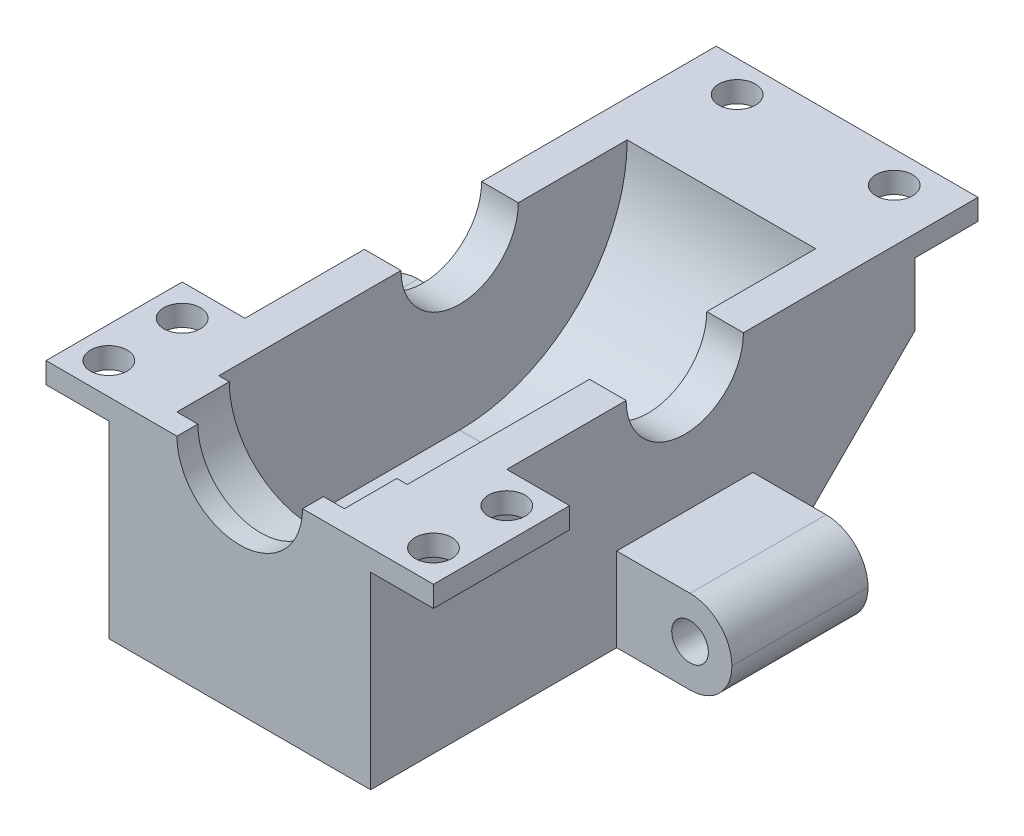
from build123d import *

# Parameters (mm, degrees)
CROQUIS2_W                 = 25
CROQUIS2_H                 = 50
SALIENTE_EXTRUIR2_DEPTH    = 20
CROQUIS19_W                = 25
CROQUIS19_H                = 20
SALIENTE_EXTRUIR8_DEPTH    = 6
CORTAR_EXTRUIR1_DEPTH      = 9
CORTAR_EXTRUIR2_DEPTH      = 39.951893407
CORTAR_EXTRUIR2_DEPTH_BACK = 39.951893407
CROQUIS9_R                 = 8
CORTAR_EXTRUIR3_DEPTH      = 5
SALIENTE_EXTRUIR9_DEPTH    = 2
CROQUIS11_W                = 13
CROQUIS11_H                = 2
SALIENTE_EXTRUIR4_DEPTH    = 6
CROQUIS13_W                = 13
CROQUIS13_H                = 2
SALIENTE_EXTRUIR5_DEPTH    = 6
CROQUIS16_R                = 1.75
CORTAR_EXTRUIR6_DEPTH      = 43.793106922
CROQUIS17_W                = 13
CROQUIS17_H                = 8
SALIENTE_EXTRUIR7_DEPTH    = 11
REDONDEO1_R                = 4
CROQUIS12_R                = 1.75
CORTAR_EXTRUIR4_DEPTH      = 46.180194776
CROQUIS14_R                = 1.75
CORTAR_EXTRUIR5_DEPTH      = 46.180194776
CROQUIS18_R                = 1.75
CORTAR_EXTRUIR7_DEPTH      = 48.796443382
REDONDEO1_OF_SIMETR_A1_R   = 4
CROQUIS23_W                = 25
CROQUIS23_H                = 18
CORTAR_EXTRUIR9_DEPTH      = 6
CHAFL_N1_SIZE              = 12


with BuildPart() as part:
    # Croquis2 → Saliente-Extruir2 (new body)
    with BuildSketch(Plane(origin=(0, 0, 0), x_dir=(1, 0, 0), z_dir=(0, 1, 0))):
        Rectangle(CROQUIS2_W, CROQUIS2_H)
    extrude(amount=SALIENTE_EXTRUIR2_DEPTH)

    # Croquis19 → Saliente-Extruir8 (add)
    with BuildSketch(Plane.XY.offset(25)):
        with Locations((0, 10)):
            Rectangle(CROQUIS19_W, CROQUIS19_H)
    extrude(amount=SALIENTE_EXTRUIR8_DEPTH)

    # Croquis4 → Cortar-Extruir1 (cut, symmetric)
    with BuildSketch(Plane(origin=(0, 0, 0), x_dir=(0, 0, -1), z_dir=(1, 0, 0))):
        with BuildLine():
            Line((-26, 4), (-3, 4))
            ThreePointArc((-3, 4), (8.313708499, 8.686291501), (13, 20))
            Line((13, 20), (-26, 20))
            Line((-26, 20), (-26, 4))
        make_face()
    extrude(amount=CORTAR_EXTRUIR1_DEPTH, both=True, mode=Mode.SUBTRACT)

    # Croquis5 → Cortar-Extruir2 (cut, two sides: drawn at the far end of the back side and taken through both)
    with BuildSketch(Plane(origin=(0, 0, 0), x_dir=(0, 0, -1), z_dir=(1, 0, 0)).offset(-CORTAR_EXTRUIR2_DEPTH_BACK)):
        with BuildLine():
            ThreePointArc((2.6, 20), (-3, 25.6), (-8.6, 20))
            Line((-8.6, 20), (2.6, 20))
        make_face()
        with BuildLine():
            Line((2.6, 20), (-8.6, 20))
            ThreePointArc((-8.6, 20), (-3, 14.4), (2.6, 20))
        make_face()
    extrude(amount=CORTAR_EXTRUIR2_DEPTH + CORTAR_EXTRUIR2_DEPTH_BACK, mode=Mode.SUBTRACT)

    # Croquis9 → Cortar-Extruir3 (cut)
    with BuildSketch(Plane.XY.offset(31)):
        with Locations((0, 20)):
            Circle(CROQUIS9_R)
    extrude(amount=-CORTAR_EXTRUIR3_DEPTH, mode=Mode.SUBTRACT)

    # Croquis22 → Saliente-Extruir9 (add)
    with BuildSketch(Plane.XY.offset(31)):
        with BuildLine():
            Line((6, 20), (12.5, 20))
            Line((12.5, 20), (12.5, 0))
            Line((12.5, 0), (-12.5, 0))
            Line((-12.5, 0), (-12.5, 20))
            Line((-12.5, 20), (-6, 20))
            ThreePointArc((-6, 20), (0, 14), (6, 20))
        make_face()
    extrude(amount=SALIENTE_EXTRUIR9_DEPTH)

    # Croquis11 → Saliente-Extruir4 (add)
    with BuildSketch(Plane(origin=(12.5, 0, 0), x_dir=(0, 0, -1), z_dir=(1, 0, 0))):
        with Locations((-26.5, 19)):
            Rectangle(CROQUIS11_W, CROQUIS11_H)
    extrude(amount=SALIENTE_EXTRUIR4_DEPTH)

    # Croquis13 → Saliente-Extruir5 (add)
    with BuildSketch(Plane.ZY.offset(12.5)):
        with Locations((26.5, 19)):
            Rectangle(CROQUIS13_W, CROQUIS13_H)
    extrude(amount=SALIENTE_EXTRUIR5_DEPTH)

    # Croquis16 → Cortar-Extruir6 (cut, through all)
    with BuildSketch(Plane(origin=(0, 20, 0), x_dir=(1, 0, 0), z_dir=(0, 1, 0))):
        with Locations(Location((-7.5, 22, 0), (0, 0, 270))):
            Circle(CROQUIS16_R)
        with Locations(Location((7.5, 22, 0), (0, 0, 270))):
            Circle(CROQUIS16_R)
    extrude(amount=-CORTAR_EXTRUIR6_DEPTH, mode=Mode.SUBTRACT)

    # Croquis17 → Saliente-Extruir7 (add)
    with BuildSketch(Plane.ZY.offset(12.5)):
        with Locations((3, 4)):
            Rectangle(CROQUIS17_W, CROQUIS17_H)
    saliente_extruir7 = extrude(amount=SALIENTE_EXTRUIR7_DEPTH)

    # Redondeo1
    redondeo1_edges = [part.edges().sort_by_distance(p)[0] for p in [
        (-23.5, 0, 3),
        (-23.5, 8, 3),
    ]]
    fillet(redondeo1_edges, radius=REDONDEO1_R - 0.0001)  # a hair under: the kernel refuses the full size

    # Croquis12 → Cortar-Extruir4 (cut, through all)
    with BuildSketch(Plane(origin=(0, 20, 0), x_dir=(1, 0, 0), z_dir=(0, 1, 0))):
        with Locations(Location((15.5, -23, 0), (0, 0, 270))):
            Circle(CROQUIS12_R)
        with Locations(Location((15.5, -30, 0), (0, 0, 270))):
            Circle(CROQUIS12_R)
    extrude(amount=-CORTAR_EXTRUIR4_DEPTH, mode=Mode.SUBTRACT)

    # Croquis14 → Cortar-Extruir5 (cut, through all)
    with BuildSketch(Plane(origin=(0, 20, 0), x_dir=(1, 0, 0), z_dir=(0, 1, 0))):
        with Locations(Location((-15.5, -23, 0), (0, 0, 270))):
            Circle(CROQUIS14_R)
        with Locations(Location((-15.5, -30, 0), (0, 0, 270))):
            Circle(CROQUIS14_R)
    extrude(amount=-CORTAR_EXTRUIR5_DEPTH, mode=Mode.SUBTRACT)

    # Croquis18 → Cortar-Extruir7 (cut, through all)
    with BuildSketch(Plane(origin=(0, 0, -3.5), x_dir=(-1, 0, 0), z_dir=(0, 0, -1))):
        with Locations((19.5, 4)):
            Circle(CROQUIS18_R)
    cortar_extruir7 = extrude(amount=-CORTAR_EXTRUIR7_DEPTH, mode=Mode.SUBTRACT)

    # Simetría1: Saliente-Extruir7, Cortar-Extruir7 across plane
    add(saliente_extruir7.mirror(Plane(origin=(0, 0, 0), x_dir=(0, 0, 1), z_dir=(1, 0, 0))))
    add(cortar_extruir7.mirror(Plane(origin=(0, 0, 0), x_dir=(0, 0, 1), z_dir=(1, 0, 0))), mode=Mode.SUBTRACT)

    # Redondeo1 of Simetría1
    redondeo1_of_simetr_a1_edges = [part.edges().sort_by_distance(p)[0] for p in [
        (23.5, 0, 3),
        (23.5, 8, 3),
    ]]
    fillet(redondeo1_of_simetr_a1_edges, radius=REDONDEO1_OF_SIMETR_A1_R - 0.0001)  # a hair under: the kernel refuses the full size

    # Croquis23 → Cortar-Extruir9 (cut)
    with BuildSketch(Plane(origin=(0, 0, -25), x_dir=(-1, 0, 0), z_dir=(0, 0, -1))):
        with Locations((0, 9)):
            Rectangle(CROQUIS23_W, CROQUIS23_H)
    extrude(amount=-CORTAR_EXTRUIR9_DEPTH, mode=Mode.SUBTRACT)

    # Chaflán1
    chafl_n1_edges = [part.edges().sort_by_distance(p)[0] for p in [
        (0, 0, -19),
    ]]
    chamfer(chafl_n1_edges, length=CHAFL_N1_SIZE)


solid = part.part
